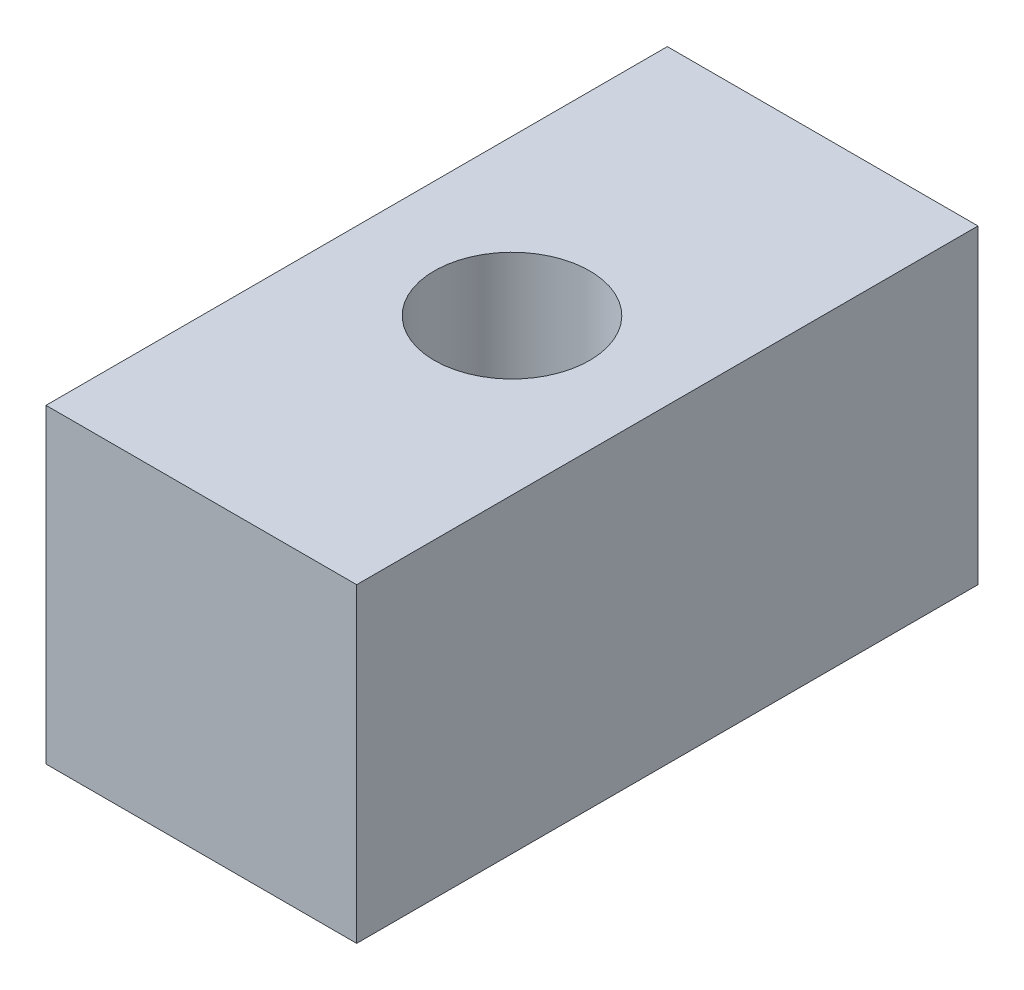
from build123d import *

# Parameters (mm, degrees)
SKETCH1_W           = 25.4
SKETCH1_H           = 50.8
BOSS_EXTRUDE1_DEPTH = 25.4
CUT_EXTRUDE1_REACH  = 40.1
SKETCH2_R           = 6.35


with BuildPart() as part:
    # Sketch1 → Boss-Extrude1 (new body)
    with BuildSketch(Plane(origin=(0, 0, 0), x_dir=(1, 0, 0), z_dir=(0, 1, 0))):
        Rectangle(SKETCH1_W, SKETCH1_H)
    extrude(amount=BOSS_EXTRUDE1_DEPTH)

    # Sketch2 → Cut-Extrude1 (cut, up to next)
    with BuildSketch(Plane(origin=(0, 25.4, 0), x_dir=(1, 0, 0), z_dir=(0, 1, 0)), mode=Mode.PRIVATE) as cut_extrude1_sk1:
        Circle(SKETCH2_R)
    cut_extrude1_tool1 = extrude(cut_extrude1_sk1.sketch, amount=-CUT_EXTRUDE1_REACH, mode=Mode.PRIVATE) & part.part
    add(cut_extrude1_tool1.solids().sort_by_distance((0, 25.4, 0))[0], mode=Mode.SUBTRACT)


solid = part.part
